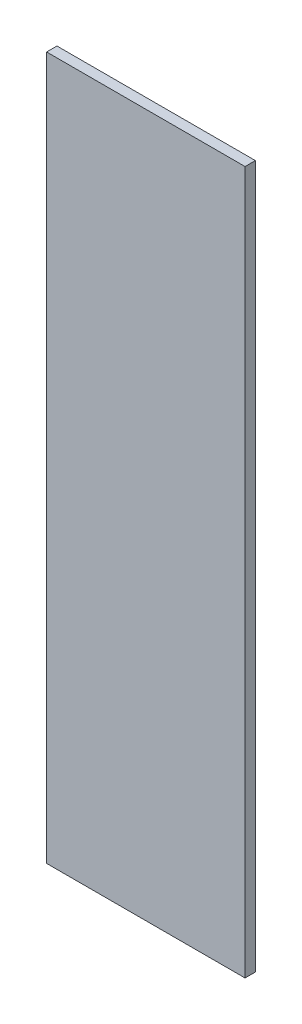
from build123d import *

# Parameters (mm, degrees)
SKETCH1_W           = 96
SKETCH1_H           = 400
BOSS_EXTRUDE1_DEPTH = 2.5
SKETCH2_W           = 359.169173544
SKETCH2_H           = 71.825535335
CUT_EXTRUDE1_DEPTH  = 206.740127345


with BuildPart() as part:
    # Sketch1 → Boss-Extrude1 (new, symmetric)
    with BuildSketch(Plane.XY):
        Rectangle(SKETCH1_W, SKETCH1_H)
    extrude(amount=BOSS_EXTRUDE1_DEPTH, both=True)

    # Sketch2 → Cut-Extrude1 (cut, through all)
    with BuildSketch(Plane.XY.offset(2.5)):
        with Locations((24.370605125, 175.912767668)):
            Rectangle(SKETCH2_W, SKETCH2_H)
    extrude(amount=-CUT_EXTRUDE1_DEPTH, mode=Mode.SUBTRACT)


solid = part.part
